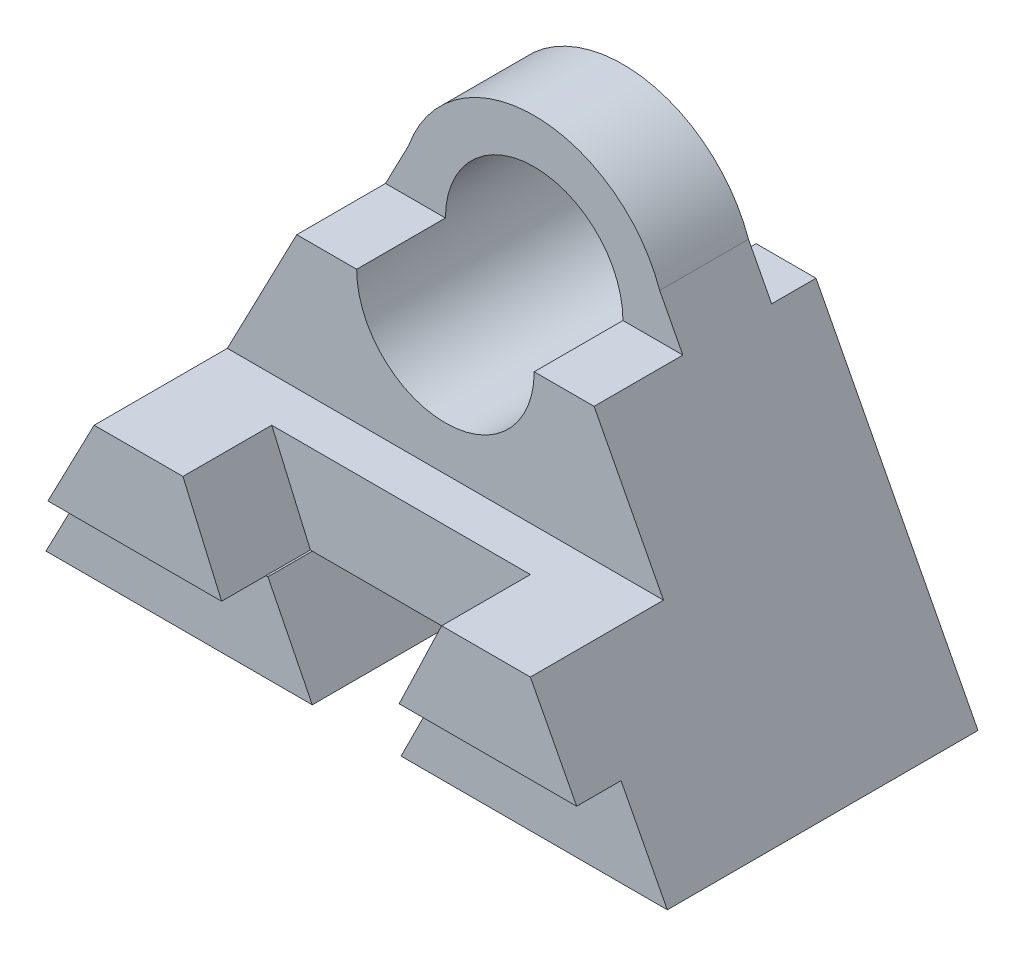
from build123d import *

# Parameters (mm, degrees)
BOSS_EXTRUDE1_DEPTH    = 14
CUT_EXTRUDE1_START     = -8
CUT_EXTRUDE1_OUTLINE_R = 2
CUT_EXTRUDE1_DEPTH     = 8
CUT_EXTRUDE2_DEPTH     = 2


# Read off the part's stored shape, not the designer's step: Cut-Extrude1
with BuildPart() as part:
    # Sketch2 → Boss-Extrude1 (new body)
    with BuildSketch(Plane(origin=(0, 0, 0), x_dir=(0, 0, -1), z_dir=(1, 0, 0))):
        Polygon((0, 0), (0, 7), (-1, 7), (-1, 10), (-3, 10), (-3, 7), (-5, 7), (-5, 4), (-8, 4), (-8, 2), (-7, 2), (-7, 0), align=None)
    extrude(amount=-BOSS_EXTRUDE1_DEPTH)

    # Cut-Extrude1 outline → Cut-Extrude1 (cut)
    with BuildSketch(Plane.XY.offset(8).offset(CUT_EXTRUDE1_START)):
        with BuildLine():
            Line((-14, 0), (-9.828427125, 8))
            ThreePointArc((-9.828427125, 8), (-8.732050808, 9.449489743), (-7, 10))
            Line((-7, 10), (-14, 10))
            Line((-14, 10), (-14, 0))
        make_face()
        Polygon((-5, 2), (-9, 2), (-8, 0), (-6, 0), align=None)
        with BuildLine():
            Line((0, 0), (0, 10))
            Line((0, 10), (-7, 10))
            ThreePointArc((-7, 10), (-5.267949192, 9.449489743), (-4.171572875, 8))
            Line((-4.171572875, 8), (0, 0))
        make_face()
        with Locations((-7, 7)):
            Circle(CUT_EXTRUDE1_OUTLINE_R)
    extrude(amount=CUT_EXTRUDE1_DEPTH, mode=Mode.SUBTRACT)

    # Sketch4 → Cut-Extrude2 (cut)
    with BuildSketch(Plane.XY.offset(8)):
        Polygon((-9.914213562, 4), (-9.042893219, 2), (-5.042893219, 2), (-4.085786438, 4), align=None)
    extrude(amount=-CUT_EXTRUDE2_DEPTH, mode=Mode.SUBTRACT)


solid = part.part
